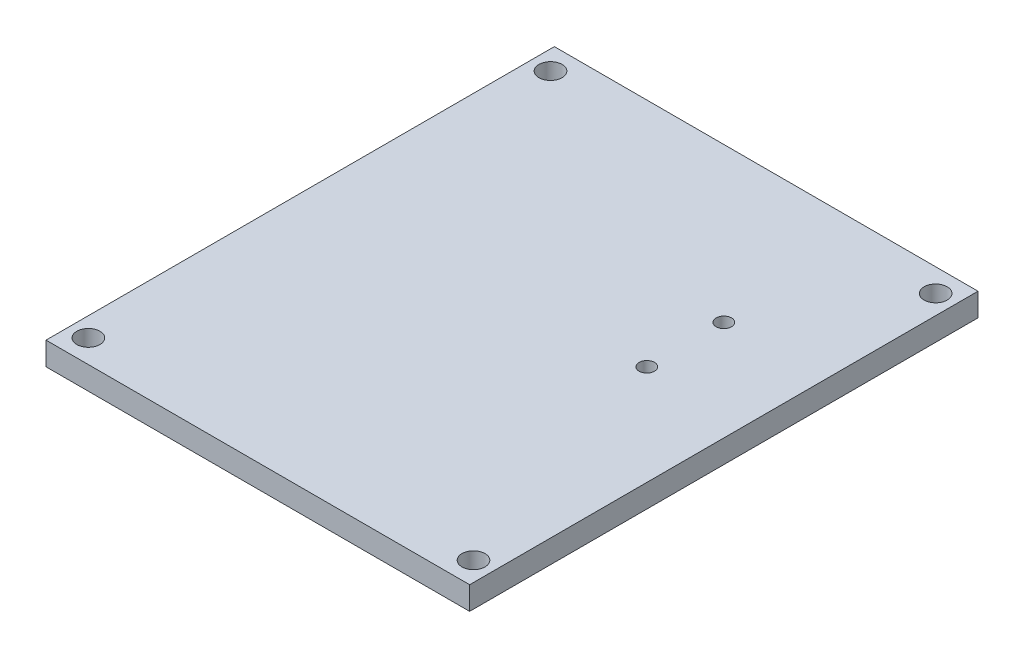
from build123d import *

# Parameters (mm, degrees)
ESQUISSE1_W        = 55
ESQUISSE1_H        = 66
ESQUISSE1_R        = 1.5
ESQUISSE1_R_2      = 1
BOSS_EXTRU_1_DEPTH = 3


with BuildPart() as part:
    # Esquisse1 → Boss.-Extru.1 (new body)
    with BuildSketch(Plane(origin=(0, 0, 0), x_dir=(1, 0, 0), z_dir=(0, 1, 0))):
        with Locations((-0.039557044, -0.082747187)):
            Rectangle(ESQUISSE1_W, ESQUISSE1_H)
        with Locations((-25.039557044, 29.917252813)):
            Circle(ESQUISSE1_R, mode=Mode.SUBTRACT)
        with Locations((24.960442956, 29.917252813)):
            Circle(ESQUISSE1_R, mode=Mode.SUBTRACT)
        with Locations((24.960442956, -30.082747187)):
            Circle(ESQUISSE1_R, mode=Mode.SUBTRACT)
        with Locations((-25.039557044, -30.082747187)):
            Circle(ESQUISSE1_R, mode=Mode.SUBTRACT)
        with Locations((14.460442956, 12.917252813)):
            Circle(ESQUISSE1_R_2, mode=Mode.SUBTRACT)
        with Locations((14.460442956, 2.917252813)):
            Circle(ESQUISSE1_R_2, mode=Mode.SUBTRACT)
    extrude(amount=BOSS_EXTRU_1_DEPTH)


solid = part.part
